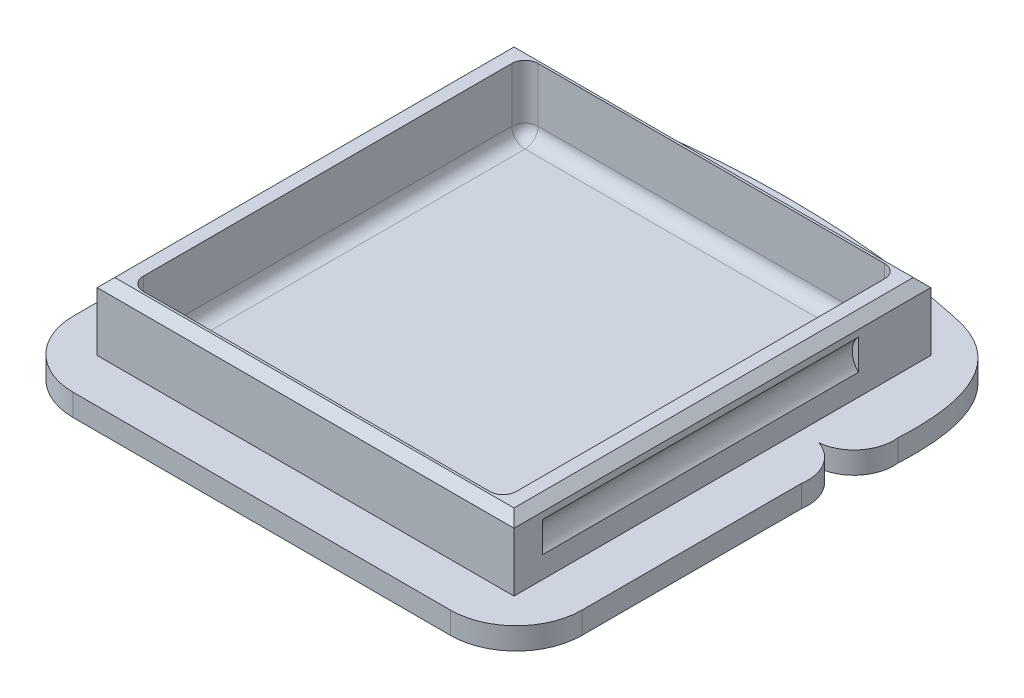
from build123d import *

# Parameters (mm, degrees)
BOSS_EXTRUDE1_DEPTH     = 6.35
SKETCH3_W               = 120.65
SKETCH3_H               = 120.65
SKETCH3_W_2             = 107.95
SKETCH3_H_2             = 114.3
BOSS_EXTRUDE2_DEPTH     = 19.558
FILLET2_R               = 3.81
CUT_EXTRUDE2_DEPTH      = 52.07
CUT_EXTRUDE2_DEPTH_BACK = 39.37
FILLET3_R               = 3.81
CHAMFER1_SIZE           = 2.54


with BuildPart() as part:
    # Sketch2 → Boss-Extrude1 (new body)
    with BuildSketch(Plane(origin=(0, 0, 0), x_dir=(1, 0, 0), z_dir=(0, 1, 0))):
        with BuildLine():
            ThreePointArc((-76.2, 34.925), (-73.750256121, 26.470795103), (-66.04, 22.225))
            ThreePointArc((-66.04, 22.225), (-71.103893825, 18.75335434), (-73.66, 13.171090867))
            Line((-73.66, 13.171090867), (-73.66, -53.975))
            ThreePointArc((-73.66, -53.975), (-68.080384182, -67.445384182), (-54.61, -73.025))
            Line((-54.61, -73.025), (54.61, -73.025))
            ThreePointArc((54.61, -73.025), (68.080384182, -67.445384182), (73.66, -53.975))
            Line((73.66, -53.975), (73.66, 9.525))
            ThreePointArc((73.66, 9.525), (72.166535166, 17.2649211), (66.04, 22.225))
            ThreePointArc((66.04, 22.225), (73.750256121, 26.470795103), (76.2, 34.925))
            add(Edge.make_bspline(
                [(54.26154132, 73.334062346), (78.033661383, 68.772092229), (76.2, 34.925)],
                knots=[0, 0, 0, 1, 1, 1], degree=2))
            ThreePointArc((54.26154132, 73.334062346), (0, 79.119757765), (-54.26154132, 73.334062346))
            add(Edge.make_bspline(
                [(-54.26154132, 73.334062346), (-78.033661383, 68.772092229), (-76.2, 34.925)],
                knots=[0, 0, 0, 1, 1, 1], degree=2))
        make_face()
    extrude(amount=BOSS_EXTRUDE1_DEPTH)

    # Sketch3 → Boss-Extrude2 (add)
    with BuildSketch(Plane(origin=(0, 6.35, 0), x_dir=(1, 0, 0), z_dir=(0, 1, 0))):
        Rectangle(SKETCH3_W, SKETCH3_H)
        Rectangle(SKETCH3_W_2, SKETCH3_H_2, mode=Mode.SUBTRACT)
    extrude(amount=BOSS_EXTRUDE2_DEPTH)

    # Fillet2
    fillet2_edges = [part.edges().sort_by_distance(p)[0] for p in [
        (53.975, 6.35, 0),
        (0, 6.35, -57.15),
        (-53.975, 6.35, 0),
        (0, 6.35, 57.15),
    ]]
    fillet(fillet2_edges, radius=FILLET2_R)

    # Sketch5 → Cut-Extrude2 (cut, two sides: drawn at the far end of the back side and taken through both)
    with BuildSketch(Plane.XY.offset(-CUT_EXTRUDE2_DEPTH_BACK)):
        with BuildLine():
            Line((60.325, 21.4247353), (60.325, 12.6112647))
            ThreePointArc((60.325, 12.6112647), (58.547, 17.018), (60.325, 21.4247353))
        make_face()
        with BuildLine():
            Line((-60.325, 21.4247353), (-60.325, 12.6112647))
            ThreePointArc((-60.325, 12.6112647), (-58.547, 17.018), (-60.325, 21.4247353))
        make_face()
    extrude(amount=CUT_EXTRUDE2_DEPTH + CUT_EXTRUDE2_DEPTH_BACK, mode=Mode.SUBTRACT)

    # Fillet3
    # the kernel refuses this fillet: 3.81 mm, written as the material it adds along each edge
    with BuildSketch(Plane(origin=(-50.165, 10.16, 53.34), x_dir=(0, 0, 1), z_dir=(-1, 0, 0))) as fillet3_piece_1_section:
        Polygon((0, 0), (FILLET3_R, 0), (FILLET3_R, -FILLET3_R), (0, -FILLET3_R), align=None)
    fillet3_piece_1 = extrude(amount=FILLET3_R, mode=Mode.PRIVATE)
    fillet3_piece_1 = fillet3_piece_1 - Plane(origin=(-50.165, 10.16, 53.34), x_dir=(0, 0.7071067811865475, -0.7071067811865475), z_dir=(-1, 0, 0)) * Sphere(FILLET3_R, mode=Mode.PRIVATE)
    add(fillet3_piece_1)
    with BuildSketch(Plane(origin=(-50.165, 10.16, -53.34), x_dir=(0, 0, -1), z_dir=(-1, 0, 0))) as fillet3_piece_2_section:
        Polygon((0, 0), (FILLET3_R, 0), (FILLET3_R, FILLET3_R), (0, FILLET3_R), align=None)
    fillet3_piece_2 = extrude(amount=FILLET3_R, mode=Mode.PRIVATE)
    fillet3_piece_2 = fillet3_piece_2 - Plane(origin=(-50.165, 10.16, -53.34), x_dir=(0, 0.7071067811865475, 0.7071067811865475), z_dir=(-1, 0, 0)) * Sphere(FILLET3_R, mode=Mode.PRIVATE)
    add(fillet3_piece_2)
    with BuildSketch(Plane(origin=(50.165, 10.16, 53.34), x_dir=(1, 0, 0), z_dir=(0, 0, 1))) as fillet3_piece_3_section:
        Polygon((0, 0), (FILLET3_R, 0), (FILLET3_R, -FILLET3_R), (0, -FILLET3_R), align=None)
    fillet3_piece_3 = extrude(amount=FILLET3_R, mode=Mode.PRIVATE)
    fillet3_piece_3 = fillet3_piece_3 - Plane(origin=(50.165, 10.16, 53.34), x_dir=(-0.7071067811865475, 0.7071067811865475, 0), z_dir=(0, 0, 1)) * Sphere(FILLET3_R, mode=Mode.PRIVATE)
    add(fillet3_piece_3)
    with BuildSketch(Plane(origin=(50.165, 10.16, -53.34), x_dir=(1, 0, 0), z_dir=(0, 0, -1))) as fillet3_piece_4_section:
        Polygon((0, 0), (FILLET3_R, 0), (FILLET3_R, FILLET3_R), (0, FILLET3_R), align=None)
    fillet3_piece_4 = extrude(amount=FILLET3_R, mode=Mode.PRIVATE)
    fillet3_piece_4 = fillet3_piece_4 - Plane(origin=(50.165, 10.16, -53.34), x_dir=(-0.7071067811865475, 0.7071067811865475, 0), z_dir=(0, 0, -1)) * Sphere(FILLET3_R, mode=Mode.PRIVATE)
    add(fillet3_piece_4)
    with BuildSketch(Plane(origin=(53.975, 10.16, -57.15), x_dir=(-1, 0, 0), z_dir=(0, 1, 0)), Plane(origin=(-53.975, 10.16, -57.15), x_dir=(0, 0, 1), z_dir=(0, 1, 0))) as fillet3_piece_5:
        with BuildLine():
            CenterArc((FILLET3_R, FILLET3_R), FILLET3_R, 180, 90)
            Line((0, FILLET3_R), (0, 0))
            Line((0, 0), (FILLET3_R, 0))
        make_face()
    extrude(amount=15.748)
    with BuildSketch(Plane(origin=(-53.975, 10.16, 57.15), x_dir=(0, 0, -1), z_dir=(0, 1, 0)), Plane(origin=(53.975, 10.16, 57.15), x_dir=(-1, 0, 0), z_dir=(0, 1, 0))) as fillet3_piece_6:
        with BuildLine():
            CenterArc((FILLET3_R, -FILLET3_R), FILLET3_R, 90, 90)
            Line((0, -FILLET3_R), (0, 0))
            Line((0, 0), (FILLET3_R, 0))
        make_face()
    extrude(amount=15.748)

    # Chamfer1
    chamfer1_edges = [part.edges().sort_by_distance(p)[0] for p in [
        (60.325, 25.908, 0),
        (0, 25.908, -60.325),
        (-60.325, 25.908, 0),
        (0, 25.908, 60.325),
    ]]
    chamfer(chamfer1_edges, length=CHAMFER1_SIZE)


solid = part.part
